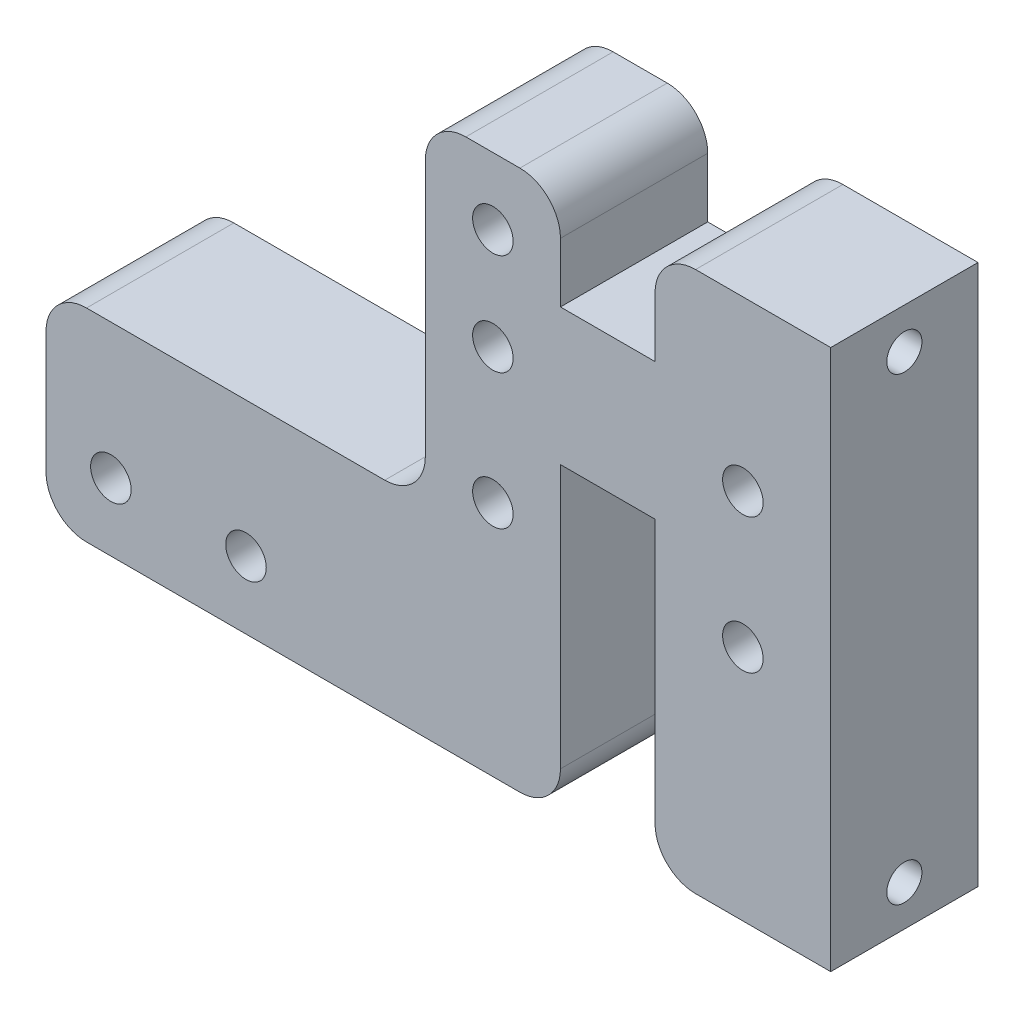
from build123d import *

# Parameters (mm, degrees)
SKETCH_1_R          = 1.5
EXTRUDE_1_DEPTH     = 10.9
SKETCH_2_R          = 1.3
CUT_EXTRUDE_1_DEPTH = 13
SKETCH_5_R          = 5.1
CUT_EXTRUDE_3_DEPTH = 37.903132997
SKETCH_6_R          = 1.5
CUT_EXTRUDE_4_DEPTH = 37.903132997
SKETCH_7_W          = 28.07
SKETCH_7_H          = 25
CUT_EXTRUDE_5_DEPTH = 37.903132997
FILLET_2_R          = 3


with BuildPart() as part:
    # ｽｹｯﾁ1 → ﾎﾞｽ - 押し出し1 (new body)
    with BuildSketch(Plane.XY):
        Polygon((9.035, 12.6), (9.035, 20), (-29.035, 20), (-29.035, -20), (9.035, -20), (9.035, 2.5), (16.035, 2.5), (16.035, -20), (29.035, -20), (29.035, 20), (16.035, 20), (16.035, 12.6), align=None)
        with Locations((4.035, -2.45)):
            Circle(SKETCH_1_R, mode=Mode.SUBTRACT)
        with Locations((22.535, -2.45)):
            Circle(SKETCH_1_R, mode=Mode.SUBTRACT)
        with Locations((4.035, 7.55)):
            Circle(SKETCH_1_R, mode=Mode.SUBTRACT)
        with Locations((22.535, 7.55)):
            Circle(SKETCH_1_R, mode=Mode.SUBTRACT)
        with Locations((4.035, 15.05)):
            Circle(SKETCH_1_R, mode=Mode.SUBTRACT)
    extrude(amount=EXTRUDE_1_DEPTH)

    # ｽｹｯﾁ2 → ｶｯﾄ - 押し出し1 (cut)
    with BuildSketch(Plane(origin=(29.035, 0, 0), x_dir=(0, 0, -1), z_dir=(1, 0, 0))):
        with Locations((-5.45, 17)):
            Circle(SKETCH_2_R)
        with Locations(Location((-5.45, -17, 0), (0, 0, 270))):
            Circle(SKETCH_2_R)
    extrude(amount=-CUT_EXTRUDE_1_DEPTH, mode=Mode.SUBTRACT)

    # ｽｹｯﾁ5 → ｶｯﾄ - 押し出し3 (cut, through all)
    with BuildSketch(Plane.XY.offset(10.9)):
        with Locations((-29.035, 24)):
            Circle(SKETCH_5_R)
        with Locations((-8.935, 24)):
            Circle(SKETCH_5_R)
    extrude(amount=-CUT_EXTRUDE_3_DEPTH, mode=Mode.SUBTRACT)

    # ｽｹｯﾁ6 → ｶｯﾄ - 押し出し4 (cut, through all)
    with BuildSketch(Plane.XY.offset(10.9)):
        with Locations((-24.235, -15)):
            Circle(SKETCH_6_R)
        with Locations((-14.235, -15)):
            Circle(SKETCH_6_R)
    extrude(amount=-CUT_EXTRUDE_4_DEPTH, mode=Mode.SUBTRACT)

    # ｽｹｯﾁ7 → ｶｯﾄ - 押し出し5 (cut, through all)
    with BuildSketch(Plane.XY.offset(10.9)):
        with Locations((-15, 7.5)):
            Rectangle(SKETCH_7_W, SKETCH_7_H)
    extrude(amount=-CUT_EXTRUDE_5_DEPTH, mode=Mode.SUBTRACT)

    # ﾌｨﾚｯﾄ2
    # the kernel refuses this fillet: 3 mm, written as the material it adds along each edge
    with BuildSketch(Plane(origin=(-0.965, -5, 10.9), x_dir=(-1, 0, 0), z_dir=(0, 0, -1))) as fillet_2_piece_1:
        with BuildLine():
            CenterArc((FILLET_2_R, FILLET_2_R), FILLET_2_R, 180, 90)
            Line((0, FILLET_2_R), (0, 0))
            Line((0, 0), (FILLET_2_R, 0))
        make_face()
    extrude(amount=10.9)
    # the kernel refuses this fillet: 3 mm, written as the material it takes off along each edge
    with BuildSketch(Plane(origin=(-29.035, -5, 18.4), x_dir=(0, -1, 0), z_dir=(0, 0, -1)), Plane(origin=(-0.965, 20, 18.4), x_dir=(0, -1, 0), z_dir=(0, 0, -1))) as fillet_2_2_piece_1:
        with BuildLine():
            CenterArc((FILLET_2_R, -FILLET_2_R), FILLET_2_R, 90, 90)
            Line((0, -FILLET_2_R), (0, 0))
            Line((0, 0), (FILLET_2_R, 0))
        make_face()
    extrude(amount=25.9, mode=Mode.SUBTRACT)
    with BuildSketch(Plane(origin=(9.035, -20, -7.5), x_dir=(0, 1, 0), z_dir=(0, 0, 1)), Plane(origin=(-29.035, -20, -7.5), x_dir=(1, 0, 0), z_dir=(0, 0, 1)), Plane(origin=(9.035, 20, -7.5), x_dir=(-1, 0, 0), z_dir=(0, 0, 1)), Plane(origin=(16.035, 20, -7.5), x_dir=(0, -1, 0), z_dir=(0, 0, 1)), Plane(origin=(16.035, -20, -7.5), x_dir=(1, 0, 0), z_dir=(0, 0, 1))) as fillet_2_2_piece_2:
        with BuildLine():
            CenterArc((FILLET_2_R, FILLET_2_R), FILLET_2_R, 180, 90)
            Line((0, FILLET_2_R), (0, 0))
            Line((0, 0), (FILLET_2_R, 0))
        make_face()
    extrude(amount=25.9, mode=Mode.SUBTRACT)


solid = part.part
